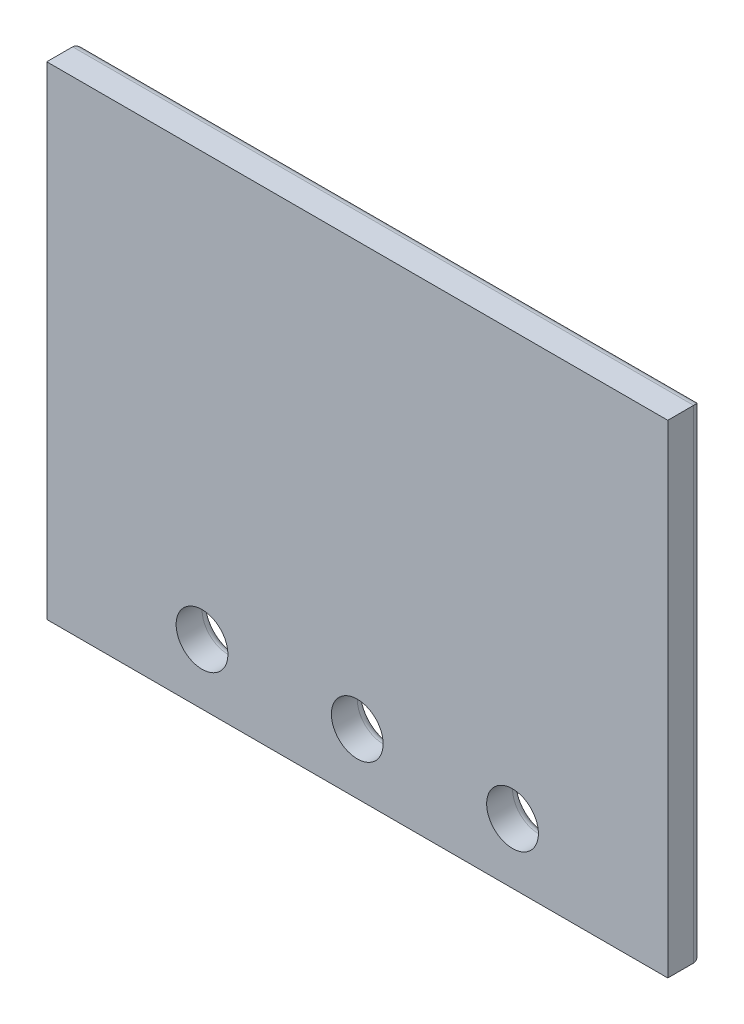
from build123d import *

# Parameters (mm, degrees)
SCHIZZO1_W                   = 360
SCHIZZO1_H                   = 280
SCHIZZO1_R                   = 15
ESTRUSIONE_ESTRUSIONE1_DEPTH = 20
SCHIZZO2_W                   = 150
SCHIZZO2_H                   = 30
ESTRUSIONE_ESTRUSIONE2_DEPTH = 60
SCHIZZO3_W                   = 120
SCHIZZO3_H                   = 45
TAGLIO_ESTRUSIONE2_DEPTH     = 30
RACCORDO2_R                  = 10
RACCORDO3_R                  = 10
RACCORDO4_R                  = 10
RACCORDO5_R                  = 10
RACCORDO6_R                  = 10
RACCORDO7_R                  = 10
RACCORDO8_R                  = 10
RACCORDO12_R                 = 5


with BuildPart() as part:
    # Schizzo1 → Estrusione-Estrusione1 (new body)
    with BuildSketch(Plane.XY):
        Rectangle(SCHIZZO1_W, SCHIZZO1_H)
        with Locations((-90, -105)):
            Circle(SCHIZZO1_R, mode=Mode.SUBTRACT)
        with Locations((90, -105)):
            Circle(SCHIZZO1_R, mode=Mode.SUBTRACT)
        with Locations((0, -105)):
            Circle(SCHIZZO1_R, mode=Mode.SUBTRACT)
    extrude(amount=ESTRUSIONE_ESTRUSIONE1_DEPTH)

    # Schizzo2 → Estrusione-Estrusione2 (add)
    with BuildSketch(Plane(origin=(0, 0, 0), x_dir=(-1, 0, 0), z_dir=(0, 0, -1))):
        with Locations((0, -55)):
            Rectangle(SCHIZZO2_W, SCHIZZO2_H)
    extrude(amount=ESTRUSIONE_ESTRUSIONE2_DEPTH)

    # Schizzo3 → Taglio-Estrusione2 (cut)
    with BuildSketch(Plane.XZ.offset(70)):
        with Locations((0, -22.5)):
            Rectangle(SCHIZZO3_W, SCHIZZO3_H)
    extrude(amount=-TAGLIO_ESTRUSIONE2_DEPTH, mode=Mode.SUBTRACT)

    # Raccordo2
    raccordo2_edges = [part.edges().sort_by_distance(p)[0] for p in [
        (-75, -55, -60),
        (0, -40, -60),
        (75, -55, -60),
        (0, -70, -60),
    ]]
    fillet(raccordo2_edges, radius=RACCORDO2_R)

    # Raccordo3
    raccordo3_edges = [part.edges().sort_by_distance(p)[0] for p in [
        (60, -55, -45),
    ]]
    fillet(raccordo3_edges, radius=RACCORDO3_R)

    # Raccordo4
    raccordo4_edges = [part.edges().sort_by_distance(p)[0] for p in [
        (-60, -55, -45),
    ]]
    fillet(raccordo4_edges, radius=RACCORDO4_R)

    # Raccordo5
    # the kernel refuses this fillet: 10 mm, written as the material it takes off along each edge
    with BuildSketch(Plane(origin=(65, -60, -50), x_dir=(1, 0, 0), z_dir=(0, -1, 0))) as raccordo5_piece_1_section:
        Polygon((0, 0), (RACCORDO5_R, 0), (RACCORDO5_R, -RACCORDO5_R), (0, -RACCORDO5_R), align=None)
    raccordo5_piece_1 = extrude(amount=RACCORDO5_R, mode=Mode.PRIVATE)
    raccordo5_piece_1 = raccordo5_piece_1 - Plane(origin=(65, -60, -50), x_dir=(-0.7071067811865475, 0, 0.7071067811865475), z_dir=(0, -1, 0)) * Sphere(RACCORDO5_R, mode=Mode.PRIVATE)
    add(raccordo5_piece_1, mode=Mode.SUBTRACT)
    with BuildSketch(Plane(origin=(75, -70, 0), x_dir=(-1, 0, 0), z_dir=(0, 0, -1))) as raccordo5_piece_2:
        with BuildLine():
            CenterArc((RACCORDO5_R, RACCORDO5_R), RACCORDO5_R, 180, 90)
            Line((0, RACCORDO5_R), (0, 0))
            Line((0, 0), (RACCORDO5_R, 0))
        make_face()
    extrude(amount=50, mode=Mode.SUBTRACT)

    # Raccordo6
    # the kernel refuses this fillet: 10 mm, written as the material it takes off along each edge
    with BuildSketch(Plane(origin=(-65, -50, -50), x_dir=(0, 1, 0), z_dir=(-1, 0, 0))) as raccordo6_piece_1_section:
        Polygon((0, 0), (RACCORDO6_R, 0), (RACCORDO6_R, RACCORDO6_R), (0, RACCORDO6_R), align=None)
    raccordo6_piece_1 = extrude(amount=RACCORDO6_R, mode=Mode.PRIVATE)
    raccordo6_piece_1 = raccordo6_piece_1 - Plane(origin=(-65, -50, -50), x_dir=(0, -0.7071067811865475, 0.7071067811865475), z_dir=(-1, 0, 0)) * Sphere(RACCORDO6_R, mode=Mode.PRIVATE)
    add(raccordo6_piece_1, mode=Mode.SUBTRACT)
    with BuildSketch(Plane(origin=(-75, -40, 0), x_dir=(0, -1, 0), z_dir=(0, 0, -1))) as raccordo6_piece_2:
        with BuildLine():
            CenterArc((RACCORDO6_R, -RACCORDO6_R), RACCORDO6_R, 90, 90)
            Line((0, -RACCORDO6_R), (0, 0))
            Line((0, 0), (RACCORDO6_R, 0))
        make_face()
    extrude(amount=50, mode=Mode.SUBTRACT)

    # Raccordo7
    # the kernel refuses this fillet: 10 mm, written as the material it takes off along each edge
    with BuildSketch(Plane(origin=(65, -50, -50), x_dir=(1, 0, 0), z_dir=(0, 1, 0))) as raccordo7_piece_1_section:
        Polygon((0, 0), (RACCORDO7_R, 0), (RACCORDO7_R, RACCORDO7_R), (0, RACCORDO7_R), align=None)
    raccordo7_piece_1 = extrude(amount=RACCORDO7_R, mode=Mode.PRIVATE)
    raccordo7_piece_1 = raccordo7_piece_1 - Plane(origin=(65, -50, -50), x_dir=(-0.7071067811865475, 0, 0.7071067811865475), z_dir=(0, 1, 0)) * Sphere(RACCORDO7_R, mode=Mode.PRIVATE)
    add(raccordo7_piece_1, mode=Mode.SUBTRACT)
    with BuildSketch(Plane(origin=(75, -40, 0), x_dir=(-1, 0, 0), z_dir=(0, 0, -1))) as raccordo7_piece_2:
        with BuildLine():
            CenterArc((RACCORDO7_R, -RACCORDO7_R), RACCORDO7_R, 90, 90)
            Line((0, -RACCORDO7_R), (0, 0))
            Line((0, 0), (RACCORDO7_R, 0))
        make_face()
    extrude(amount=50, mode=Mode.SUBTRACT)

    # Raccordo8
    # the kernel refuses this fillet: 10 mm, written as the material it takes off along each edge
    with BuildSketch(Plane(origin=(-65, -60, -50), x_dir=(-1, 0, 0), z_dir=(0, -1, 0))) as raccordo8_piece_1_section:
        Polygon((0, 0), (RACCORDO8_R, 0), (RACCORDO8_R, RACCORDO8_R), (0, RACCORDO8_R), align=None)
    raccordo8_piece_1 = extrude(amount=RACCORDO8_R, mode=Mode.PRIVATE)
    raccordo8_piece_1 = raccordo8_piece_1 - Plane(origin=(-65, -60, -50), x_dir=(0.7071067811865475, 0, 0.7071067811865475), z_dir=(0, -1, 0)) * Sphere(RACCORDO8_R, mode=Mode.PRIVATE)
    add(raccordo8_piece_1, mode=Mode.SUBTRACT)
    with BuildSketch(Plane(origin=(-75, -70, 0), x_dir=(1, 0, 0), z_dir=(0, 0, -1))) as raccordo8_piece_2:
        with BuildLine():
            CenterArc((RACCORDO8_R, -RACCORDO8_R), RACCORDO8_R, 90, 90)
            Line((0, -RACCORDO8_R), (0, 0))
            Line((0, 0), (RACCORDO8_R, 0))
        make_face()
    extrude(amount=50, mode=Mode.SUBTRACT)

    # Raccordo12
    raccordo12_edges = [part.edges().sort_by_distance(p)[0] for p in [
        (72.071067812, -67.071067812, 0),
        (-62.5, -40, 0),
        (-72.071067812, -42.928932188, 0),
        (75, -55, 0),
        (72.071067812, -42.928932188, 0),
        (-105, -105, 0),
        (-75, -55, 0),
        (-72.071067812, -67.071067812, 0),
        (75, -105, 0),
        (-15, -105, 0),
        (-62.5, -70, 0),
        (62.5, -40, 0),
        (60, -55, 0),
        (-60, -55, 0),
        (0, -140, 0),
        (-180, 0, 0),
        (0, 140, 0),
        (180, 0, 0),
        (62.5, -70, 0),
    ]]
    fillet(raccordo12_edges, radius=RACCORDO12_R)


solid = part.part
